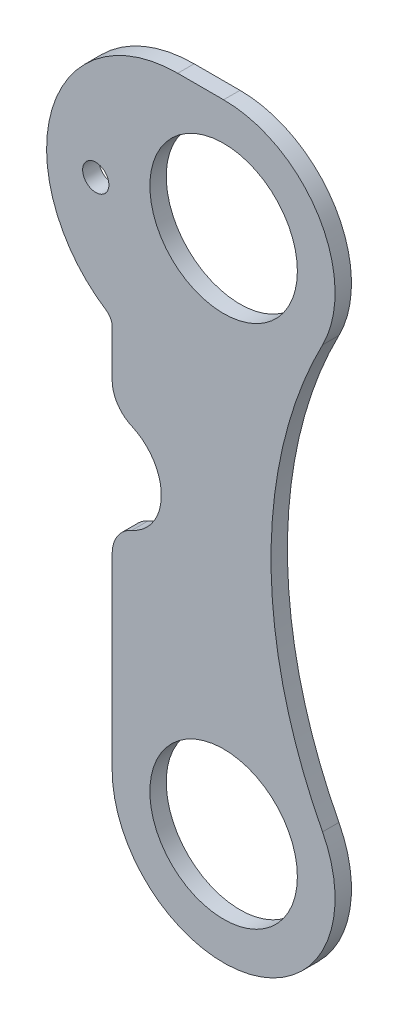
from build123d import *

# Parameters (mm, degrees)
SKETCH1_R           = 14.2875
SKETCH1_R_2         = 2.54
BOSS_EXTRUDE1_DEPTH = 3.175
CUT_EXTRUDE1_DEPTH  = 162.674043733
FILLET3_R           = 6.35
SKETCH3_R           = 2.54
BOSS_EXTRUDE3_DEPTH = 3.175
SKETCH6_R           = 2.54
BOSS_EXTRUDE4_DEPTH = 3.175
FILLET2_R           = 6.35
CUT_EXTRUDE2_DEPTH  = 169.237022961
CUT_EXTRUDE3_DEPTH  = 169.237022961
CUT_EXTRUDE4_DEPTH  = 168.265702461
SKETCH15_R          = 2.54
BOSS_EXTRUDE8_DEPTH = 3.175
FILLET4_R           = 2.54


with BuildPart() as part:
    # Sketch1 → Boss-Extrude1 (new body)
    with BuildSketch(Plane.XY):
        with BuildLine():
            Line((-8.89, 25.4), (8.89, 25.4))
            ThreePointArc((8.89, 25.4), (17.870256121, 21.680256121), (21.59, 12.7))
            Line((21.59, 12.7), (21.59, -117.775079775))
            ThreePointArc((21.59, -117.775079775), (21.127743647, -120.388718212), (19.797058824, -122.685251408))
            Line((19.797058824, -122.685251408), (-7.952696208, -155.616779465))
            ThreePointArc((-7.952696208, -155.616779465), (-12.268297602, -157.851943494), (-16.900388255, -156.380852124))
            Line((-16.900388255, -156.380852124), (-32.439211784, -143.287061102))
            ThreePointArc((-32.439211784, -143.287061102), (-34.674375812, -138.971459708), (-33.203284443, -134.339369055))
            Line((-33.203284443, -134.339369055), (-23.382941176, -122.685251408))
            ThreePointArc((-23.382941176, -122.685251408), (-22.052256353, -120.388718212), (-21.59, -117.775079775))
            Line((-21.59, -117.775079775), (-21.59, 12.7))
            ThreePointArc((-21.59, 12.7), (-17.870256121, 21.680256121), (-8.89, 25.4))
        make_face()
        Circle(SKETCH1_R, mode=Mode.SUBTRACT)
        with Locations((0, -101.6)):
            Circle(SKETCH1_R, mode=Mode.SUBTRACT)
        with Locations((-18.532085478, -142.550133084)):
            Circle(SKETCH1_R_2, mode=Mode.SUBTRACT)
    extrude(amount=BOSS_EXTRUDE1_DEPTH)

    # Sketch2 → Cut-Extrude1 (cut, through all)
    with BuildSketch(Plane.XY):
        with BuildLine():
            ThreePointArc((-21.59, -60.325), (-12.065, -50.8), (-21.59, -41.275))
            Line((-21.59, -41.275), (-21.59, -60.325))
        make_face()
        with BuildLine():
            ThreePointArc((19.159083004, -91.647229609), (21.458203844, -103.981929422), (16.51, -115.512152961))
            Line((16.51, -115.512152961), (-17.501317584, -155.874478972))
            Line((-17.501317584, -155.874478972), (-7.620284479, -163.8572221))
            Line((-7.620284479, -163.8572221), (27.94, -121.656687185))
            Line((27.94, -121.656687185), (27.94, 0))
            Line((27.94, 0), (21.59, 0))
            ThreePointArc((21.59, 0), (20.973467787, -5.122670102), (19.159083004, -9.952770391))
            ThreePointArc((19.159083004, -9.952770391), (9.182340769, -50.8), (19.159083004, -91.647229609))
        make_face()
    extrude(amount=CUT_EXTRUDE1_DEPTH, mode=Mode.SUBTRACT)


with BuildPart() as cut_extrude1_piece_1:
    # of the separate pieces the step leaves, piece 1, a body of its own (cut_extrude1_pieces)
    add(part.part.solids().sort_by_distance((-8.89, 25.4, 0))[0])

    # Fillet3
    fillet3_edges = [cut_extrude1_piece_1.edges().sort_by_distance(p)[0] for p in [
        (-21.59, -41.275, 1.5875),
        (-21.59, -60.325, 1.5875),
    ]]
    fillet(fillet3_edges, radius=FILLET3_R)

    # Sketch3 → Boss-Extrude3 (add)
    with BuildSketch(Plane.XY.offset(3.175)):
        with BuildLine():
            Line((-27.351416194, -127.394768527), (-36.025496499, -137.688579))
            ThreePointArc((-36.025496499, -137.688579), (-37.217489152, -141.441859142), (-35.4063854, -144.93869507))
            Line((-35.4063854, -144.93869507), (-24.403104784, -154.210610454))
            ThreePointArc((-24.403104784, -154.210610454), (-19.771014132, -155.681701823), (-15.455412737, -153.446537795))
            Line((-15.455412737, -153.446537795), (-7.557639641, -144.073996091))
            Line((-7.557639641, -144.073996091), (-27.351416194, -127.394768527))
        make_face()
        with Locations((-18.532085478, -142.550133084)):
            Circle(SKETCH3_R, mode=Mode.SUBTRACT)
    extrude(amount=-BOSS_EXTRUDE3_DEPTH)

    # Sketch6 → Boss-Extrude4 (add)
    with BuildSketch(Plane.XY.offset(3.175)):
        Polygon((-35.4063854, -144.93869507), (-63.620410749, -121.164144113), (-51.344981666, -106.596497054), (-27.065569901, -127.055545526), align=None)
        with Locations((-52.626813855, -117.972130278)):
            Circle(SKETCH6_R, mode=Mode.SUBTRACT)
    extrude(amount=-BOSS_EXTRUDE4_DEPTH)

    # Fillet2
    fillet2_edges = [cut_extrude1_piece_1.edges().sort_by_distance(p)[0] for p in [
        (-63.620410749, -121.164144113, 1.5875),
        (-51.344981666, -106.596497054, 1.5875),
        (-27.065569901, -127.055545526, 1.5875),
    ]]
    fillet(fillet2_edges, radius=FILLET2_R)

    # Sketch7 → Cut-Extrude2 (cut, through all)
    with BuildSketch(Plane.XY.offset(3.175)):
        with BuildLine():
            Line((-21.59, 0), (-21.59, 31.75))
            Line((-21.59, 31.75), (21.59, 31.75))
            Line((21.59, 31.75), (21.59, 0))
            ThreePointArc((21.59, 0), (0, 21.59), (-21.59, 0))
        make_face()
    extrude(amount=-CUT_EXTRUDE2_DEPTH, mode=Mode.SUBTRACT)


with BuildPart() as cut_extrude1_piece_2:
    # of the separate pieces the step leaves, piece 2, a body of its own (cut_extrude1_pieces)
    add(part.part.solids().sort_by_distance((-16.900388255, -156.380852124, 0))[0])


with BuildPart() as cut_extrude3_tool:
    # Sketch10 → Cut-Extrude3 (new, through all)
    with BuildSketch(Plane.XY.offset(3.175)):
        with BuildLine():
            Line((-18.151882461, -155.32628042), (-17.361482582, -157.512020269))
            Line((-17.361482582, -157.512020269), (-14.375706423, -156.432313955))
            Line((-14.375706423, -156.432313955), (-15.455412737, -153.446537795))
            ThreePointArc((-15.455412737, -153.446537795), (-16.679911193, -154.563907595), (-18.151882461, -155.32628042))
        make_face()
    extrude(amount=-CUT_EXTRUDE3_DEPTH)


with BuildPart() as cut_extrude1_piece_1_1:
    add(cut_extrude1_piece_1.part)

    # Cut-Extrude3: cut by cut_extrude3_tool
    add(cut_extrude3_tool.part, mode=Mode.SUBTRACT)

    # Sketch12 → Cut-Extrude4 (cut, through all)
    with BuildSketch(Plane.XY.offset(3.175)):
        with BuildLine():
            Line((-21.59, -101.6), (-72.39, -101.6))
            Line((-72.39, -101.6), (-72.39, -165.1))
            Line((-72.39, -165.1), (16.51, -165.1))
            Line((16.51, -165.1), (16.51, -115.512152961))
            ThreePointArc((16.51, -115.512152961), (-7.405308906, -121.880273667), (-21.59, -101.6))
        make_face()
    extrude(amount=-CUT_EXTRUDE4_DEPTH, mode=Mode.SUBTRACT)

    # Sketch15 → Boss-Extrude8 (add)
    with BuildSketch(Plane.XY.offset(3.175)):
        with BuildLine():
            ThreePointArc((-34.29, -3.81), (-30.887045256, -16.51), (-21.59, -25.807045256))
            Line((-21.59, -25.807045256), (-21.59, 0))
            ThreePointArc((-21.59, 0), (-15.266435406, 15.266435406), (0, 21.59))
            Line((0, 21.59), (-8.89, 21.59))
            ThreePointArc((-8.89, 21.59), (-26.850512242, 14.150512242), (-34.29, -3.81))
        make_face()
        with Locations((-24.765, -3.81)):
            Circle(SKETCH15_R, mode=Mode.SUBTRACT)
    extrude(amount=-BOSS_EXTRUDE8_DEPTH)

    # Fillet4
    fillet4_edges = [cut_extrude1_piece_1_1.edges().sort_by_distance(p)[0] for p in [
        (-21.59, -25.807045256, 1.5875),
    ]]
    fillet(fillet4_edges, radius=FILLET4_R)


with BuildPart() as cut_extrude1_piece_2_1:
    add(cut_extrude1_piece_2.part)

    # Cut-Extrude3: cut by cut_extrude3_tool
    add(cut_extrude3_tool.part, mode=Mode.SUBTRACT)


solid = cut_extrude1_piece_1_1.part
